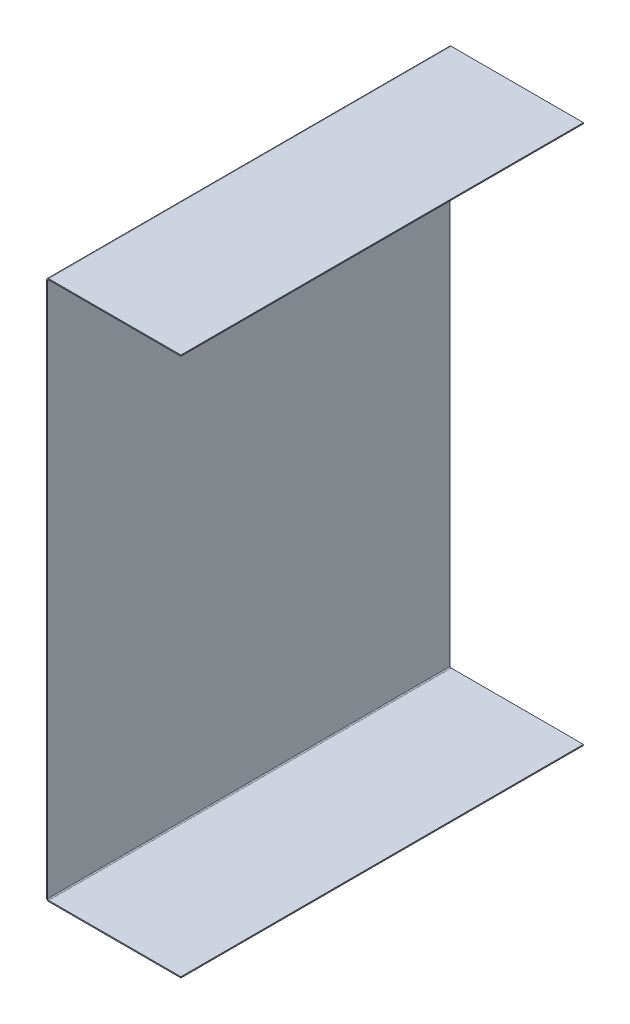
from build123d import *

# Parameters (mm, degrees)
SKETCH1_W               = 992
SKETCH1_H               = 746
BASE_FLANGE1_DEPTH      = 2
EDGE_FLANGE1_DEPTH      = 746
EDGE_FLANGE1_BEND_DEPTH = 746


# Sheet-metal steps are written as plain solids
with BuildPart() as part:
    # Sketch1 → Base-Flange1 (new body)
    with BuildSketch(Plane.YZ):
        Rectangle(SKETCH1_W, SKETCH1_H)
    extrude(amount=-BASE_FLANGE1_DEPTH)

    # Edge-Flange1 section (across the edge) → Edge-Flange1 (add)
    with BuildSketch(Plane(origin=(0, 498, -373), x_dir=(0, -1, 0), z_dir=(0, 0, 1))):
        with BuildLine():
            Line((-2, 2), (-2, 247))
            Line((-2, 247), (0, 247))
            Line((0, 247), (0, 2))
            ThreePointArc((0, 2), (0.585786438, 0.585786438), (2, 0))
            Line((2, 0), (2, -2))
            ThreePointArc((2, -2), (-0.828427125, -0.828427125), (-2, 2))
        make_face()
    extrude(amount=EDGE_FLANGE1_DEPTH)

    # Edge-Flange1 section 2 (across the edge) → Edge-Flange1 bend (add)
    with BuildSketch(Plane(origin=(0, -498, 373), x_dir=(0, 1, 0), z_dir=(0, 0, -1))):
        with BuildLine():
            Line((-2, 2), (-2, 247))
            Line((-2, 247), (0, 247))
            Line((0, 247), (0, 2))
            ThreePointArc((0, 2), (0.585786438, 0.585786438), (2, 0))
            Line((2, 0), (2, -2))
            ThreePointArc((2, -2), (-0.828427125, -0.828427125), (-2, 2))
        make_face()
    extrude(amount=EDGE_FLANGE1_BEND_DEPTH)


solid = part.part
